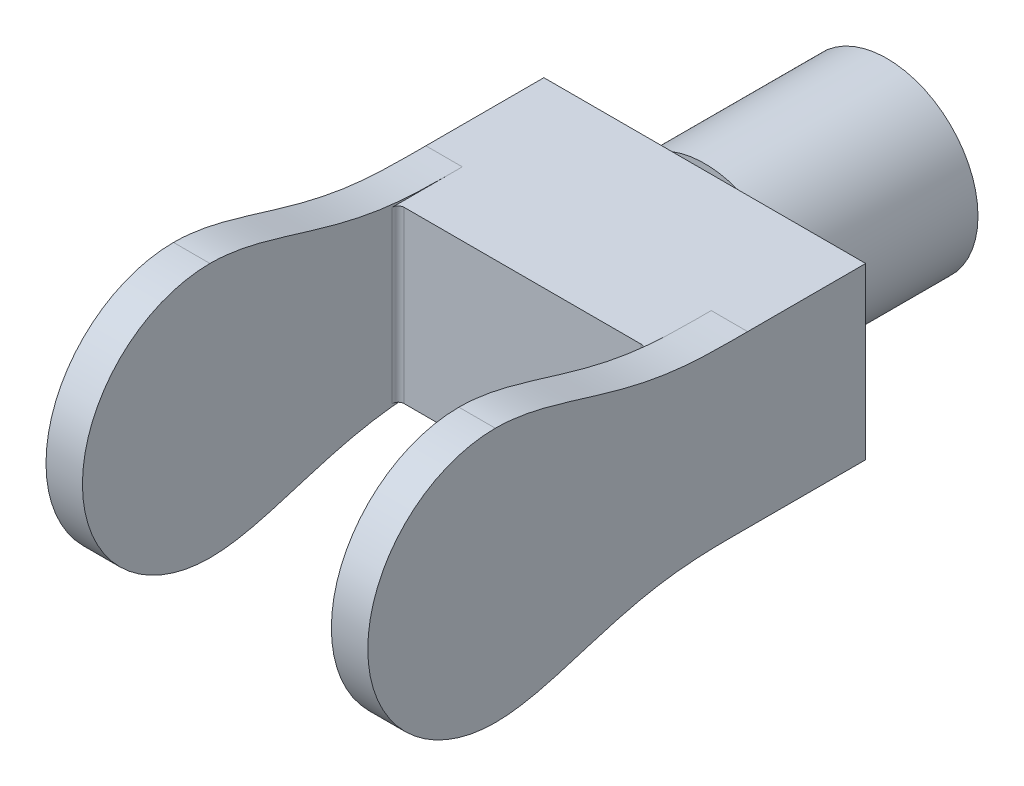
from build123d import *

# Parameters (mm, degrees)
SKETCH1_R           = 15
SKETCH1_R_2         = 13
BOSS_EXTRUDE1_DEPTH = 30
BOSS_EXTRUDE2_START = -3
SKETCH2_R           = 15
BOSS_EXTRUDE2_DEPTH = 3
SKETCH3_W           = 53
SKETCH3_H           = 28
BOSS_EXTRUDE3_DEPTH = 30
BOSS_EXTRUDE5_START = -6
BOSS_EXTRUDE5_DEPTH = 6
FILLET1_R           = 1


# Read off the part's stored shape, not the designer's step: Boss-Extrude5
with BuildPart() as part:
    # Sketch1 → Boss-Extrude1 (new body)
    with BuildSketch(Plane.XY):
        Circle(SKETCH1_R)
        Circle(SKETCH1_R_2, mode=Mode.SUBTRACT)
    extrude(amount=BOSS_EXTRUDE1_DEPTH)

    # Sketch2 → Boss-Extrude2 (add)
    with BuildSketch(Plane.XY.offset(30).offset(BOSS_EXTRUDE2_START)):
        Circle(SKETCH2_R)
    extrude(amount=BOSS_EXTRUDE2_DEPTH)

    # Sketch3 → Boss-Extrude3 (add)
    with BuildSketch(Plane.XY.offset(30)):
        Rectangle(SKETCH3_W, SKETCH3_H)
    extrude(amount=BOSS_EXTRUDE3_DEPTH)

    # Boss-Extrude5 outline → Boss-Extrude5 (add)
    with BuildSketch(Plane(origin=(26.5, 0, 0), x_dir=(0, 0, -1), z_dir=(1, 0, 0)).offset(BOSS_EXTRUDE5_START)):
        with BuildLine():
            Line((-60, 14), (-52.045674019, 14))
            add(Edge.make_bspline(
                [(-52.045674019, 14), (-61.791651738, 14.026298499), (-70.837462314, 14.567622964), (-80.6660896, 21), (-91, 21)],
                knots=[0.062270869, 0.062270869, 0.062270869, 0.062270869, 0.062270869, 1, 1, 1, 1, 1], degree=4))
            ThreePointArc((-91, 21), (-112, 0), (-91, -21))
            add(Edge.make_bspline(
                [(-91, -21), (-80.6660896, -21), (-70.837462314, -14.567622964), (-61.791651738, -14.026298499), (-52.045674019, -14)],
                knots=[0, 0, 0, 0, 0, 0.937729131, 0.937729131, 0.937729131, 0.937729131, 0.937729131], degree=4))
            Line((-52.045674019, -14), (-60, -14))
            Line((-60, -14), (-60, 14))
        make_face()
    boss_extrude5 = extrude(amount=BOSS_EXTRUDE5_DEPTH)

    # Mirror1: Boss-Extrude5 across plane
    add(boss_extrude5.mirror(Plane(origin=(0, 0, 0), x_dir=(0, 0, 1), z_dir=(1, 0, 0))))

    # Fillet1
    fillet1_edges = [part.edges().sort_by_distance(p)[0] for p in [
        (20.5, 0, 60),
        (-20.5, 0, 60),
    ]]
    fillet(fillet1_edges, radius=FILLET1_R)


solid = part.part
